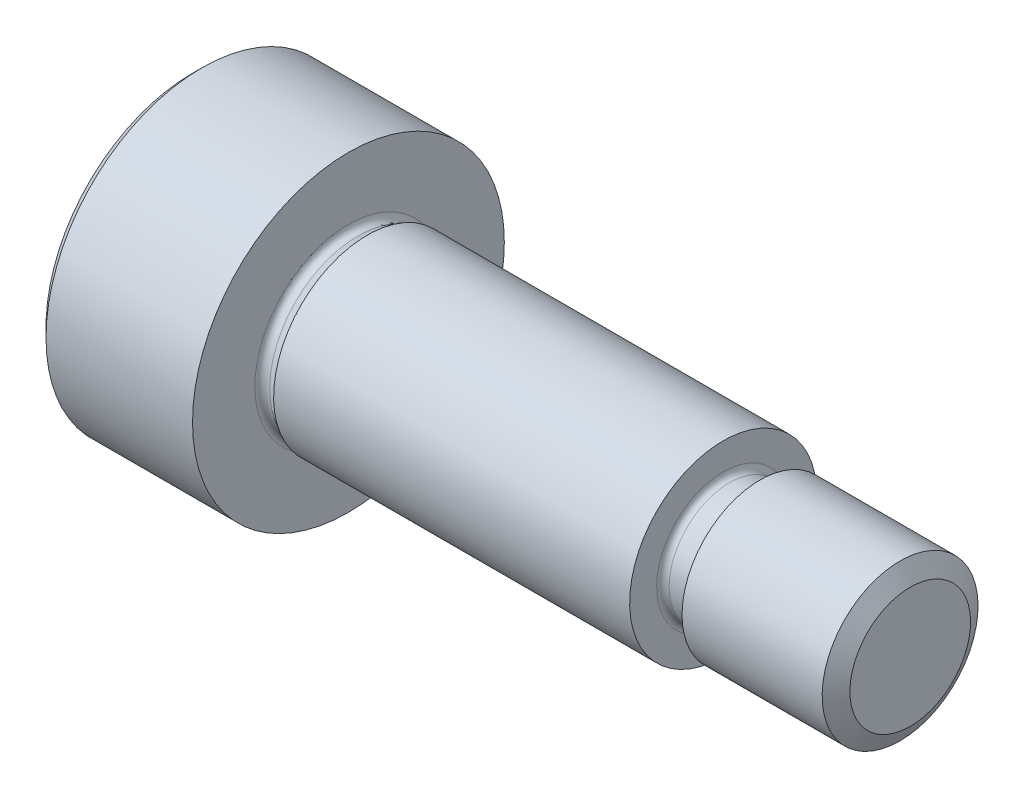
from build123d import *

# Parameters (mm, degrees)
HEXEXTRUDE_REACH = 26.082


with BuildPart() as part:
    # Sketch2 → ScrewRevolve (revolve)
    with BuildSketch(Plane.XY):
        with BuildLine():
            Line((18.02, 1.9345), (17.693508423, 2.5))
            Line((17.693508423, 2.5), (13.199474732, 2.5))
            Line((13.199474732, 2.5), (12.872983154, 1.9345))
            Line((12.872983154, 1.9345), (12.22, 1.9345))
            ThreePointArc((12.22, 1.9345), (12.078578644, 1.993078644), (12.02, 2.1345))
            Line((12.02, 2.1345), (12.02, 3))
            Line((12.02, 3), (0.6, 3))
            Line((0.6, 3), (0.3, 2.826794919))
            ThreePointArc((0.3, 2.826794919), (0.1, 2.826794919), (0, 3))
            Line((0, 3), (0, 5))
            Line((0, 5), (-4.7, 5))
            Line((-4.7, 5), (-5, 4.7))
            Line((-5, 4.7), (-5, 1.8))
            Line((-5, 1.8), (-4.7, 1.5))
            Line((-4.7, 1.5), (-2.5, 1.5))
            Line((-2.5, 1.5), (-1.598709071, 0))
            Line((-1.598709071, 0), (18.02, 0))
            Line((18.02, 0), (18.02, 1.9345))
        make_face()
    revolve(axis=Axis((-1.598709071, 0, 0), (1, 0, 0)))

    # HexExtrude: up to this cone (the profile starts inside it)
    hexextrude_end = Plane(origin=(-5, 0, 0), z_dir=(-1, 0, 0)).offset(-3.401289929) * Cone(1.664e-06, 59.321560618, 35.643988634, align=(Align.CENTER, Align.CENTER, Align.MIN), mode=Mode.PRIVATE)
    # Sketch3 → HexExtrude (cut, up to the surface)
    with BuildSketch(Plane.ZY.offset(5), mode=Mode.PRIVATE) as hexextrude_sk1:
        Polygon((-0.866025404, 1.5), (-1.732050808, 0), (-0.866025404, -1.5), (0.866025404, -1.5), (1.732050808, 0), (0.866025404, 1.5), align=None)
    hexextrude_tool1 = extrude(hexextrude_sk1.sketch, amount=-HEXEXTRUDE_REACH, mode=Mode.PRIVATE) & hexextrude_end
    add(hexextrude_tool1.solids().sort_by_distance((-5, 0, 0))[0], mode=Mode.SUBTRACT)


solid = part.part
